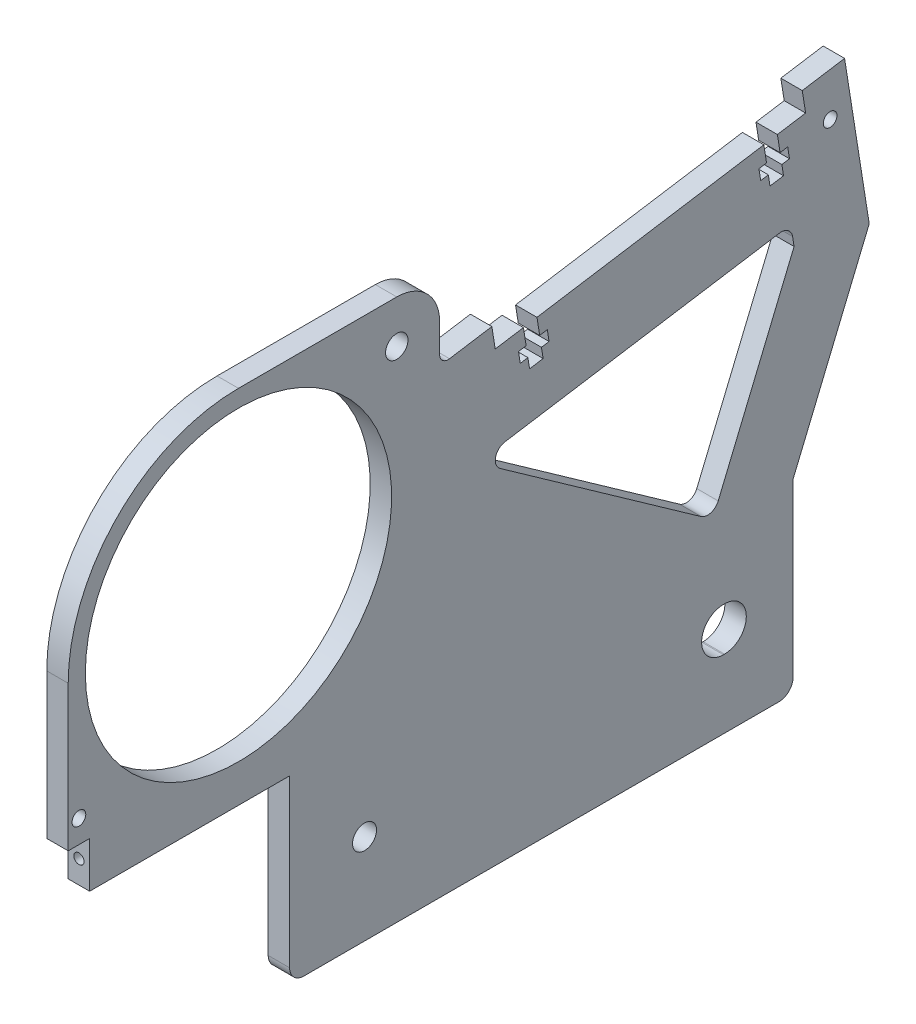
from build123d import *

# Parameters (mm, degrees)
SKETCH1_R           = 1.524
SKETCH1_R_2         = 2.667
SKETCH1_R_3         = 34.04
SKETCH1_R_4         = 2.4892
BOSS_EXTRUDE1_DEPTH = 4.7625
SKETCH2_R           = 1.1303
CUT_EXTRUDE1_DEPTH  = 6.35


with BuildPart() as part:
    # Sketch1 → Boss-Extrude1 (new body)
    with BuildSketch(Plane(origin=(0, 0, 0), x_dir=(0, 0, -1), z_dir=(1, 0, 0))):
        with BuildLine():
            Line((-28.170295117, 0), (77.382795117, 0))
            ThreePointArc((77.382795117, 0), (79.627859148, 0.92993597), (80.557795117, 3.175))
            Line((80.557795117, 3.175), (80.557795117, 38.504743526))
            Line((80.557795117, 38.504743526), (80.557795117, 41.307035595))
            Line((80.557795117, 41.307035595), (97.47645297, 81.978005717))
            Line((97.47645297, 81.978005717), (92.000706017, 116.550511334))
            Line((92.000706017, 116.550511334), (82.592974573, 115.060473054))
            Line((82.592974573, 115.060473054), (83.337993713, 110.356607332))
            Line((83.337993713, 110.356607332), (77.06617275, 109.363248479))
            Line((77.06617275, 109.363248479), (77.667154856, 105.568796797))
            Line((77.667154856, 105.568796797), (79.360546516, 105.837003687))
            Line((79.360546516, 105.837003687), (79.752923263, 103.359634407))
            Line((79.752923263, 103.359634407), (78.059531603, 103.091427516))
            Line((78.059531603, 103.091427516), (78.432041173, 100.739494655))
            Line((78.432041173, 100.739494655), (75.421567111, 100.262682406))
            Line((75.421567111, 100.262682406), (75.049057541, 102.614615267))
            Line((75.049057541, 102.614615267), (73.355665881, 102.346408377))
            Line((73.355665881, 102.346408377), (72.963289134, 104.823777657))
            Line((72.963289134, 104.823777657), (74.656680794, 105.091984547))
            Line((74.656680794, 105.091984547), (74.055698688, 108.88643623))
            Line((74.055698688, 108.88643623), (23.630258147, 100.899831052))
            Line((23.630258147, 100.899831052), (24.231240253, 97.105379369))
            Line((24.231240253, 97.105379369), (25.924631913, 97.373586259))
            Line((25.924631913, 97.373586259), (26.31700866, 94.896216979))
            Line((26.31700866, 94.896216979), (24.623617, 94.628010089))
            Line((24.623617, 94.628010089), (24.99612657, 92.276077228))
            Line((24.99612657, 92.276077228), (21.985652508, 91.799264978))
            Line((21.985652508, 91.799264978), (21.613142938, 94.151197839))
            Line((21.613142938, 94.151197839), (19.919751278, 93.882990949))
            Line((19.919751278, 93.882990949), (19.527374531, 96.360360229))
            Line((19.527374531, 96.360360229), (21.220766191, 96.62856712))
            Line((21.220766191, 96.62856712), (20.619784085, 100.423018802))
            Line((20.619784085, 100.423018802), (14.347963122, 99.429659949))
            Line((14.347963122, 99.429659949), (13.602943983, 104.133525671))
            Line((13.602943983, 104.133525671), (4.195212538, 102.643487392))
            ThreePointArc((4.195212538, 102.643487392), (2.66000635, 103.076460316), (1.992204883, 104.52503368))
            Line((1.992204883, 104.52503368), (1.992204883, 110.875))
            ThreePointArc((1.992204883, 110.875), (-0.797603027, 117.610192091), (-7.532795117, 120.4))
            Line((-7.532795117, 120.4), (-42.707795117, 120.4))
            ThreePointArc((-42.707795117, 120.4), (-69.471786785, 109.313991668), (-80.557795117, 82.55))
            Line((-80.557795117, 82.55), (-80.557795117, 50.292))
            Line((-80.557795117, 50.292), (-75.795295117, 50.292))
            Line((-75.795295117, 50.292), (-75.795295117, 40.132))
            Line((-75.795295117, 40.132), (-31.345295117, 40.132))
            Line((-31.345295117, 40.132), (-31.345295117, 3.175))
            ThreePointArc((-31.345295117, 3.175), (-30.415359148, 0.92993597), (-28.170295117, 0))
        make_face()
        with Locations((-78.176545117, 55.372)):
            Circle(SKETCH1_R, mode=Mode.SUBTRACT)
        with Locations((-14.692204883, 20.066)):
            Circle(SKETCH1_R_2, mode=Mode.SUBTRACT)
        with Locations((-42.707795117, 82.55)):
            Circle(SKETCH1_R_3, mode=Mode.SUBTRACT)
        with Locations((88.786878575, 106.39776075)):
            Circle(SKETCH1_R, mode=Mode.SUBTRACT)
        with Locations((-7.532795117, 110.875)):
            Circle(SKETCH1_R_4, mode=Mode.SUBTRACT)
        with BuildLine():
            Line((65.317795117, 15.2273), (65.063795117, 15.2273))
            ThreePointArc((65.063795117, 15.2273), (60.225095117, 20.066), (65.063795117, 24.9047))
            Line((65.063795117, 24.9047), (65.317795117, 24.9047))
            ThreePointArc((65.317795117, 24.9047), (70.156495117, 20.066), (65.317795117, 15.2273))
        make_face(mode=Mode.SUBTRACT)
        with BuildLine():
            Line((77.537520924, 90.15044205), (16.505444161, 80.48391073))
            ThreePointArc((16.505444161, 80.48391073), (14.429240829, 78.552387567), (15.436115304, 75.901424384))
            Line((15.436115304, 75.901424384), (60.099239023, 44.313277635))
            ThreePointArc((60.099239023, 44.313277635), (62.269082169, 43.94630806), (63.911091021, 45.411467736))
            Line((63.911091021, 45.411467736), (80.774519188, 85.949670538))
            Line((80.774519188, 85.949670538), (80.44359285, 88.039057206))
            ThreePointArc((80.44359285, 88.039057206), (79.427839006, 89.69661683), (77.537520924, 90.15044205))
        make_face(mode=Mode.SUBTRACT)
    extrude(amount=BOSS_EXTRUDE1_DEPTH)

    # Sketch2 → Cut-Extrude1 (cut)
    with BuildSketch(Plane.XY.offset(75.795295117)):
        with Locations((2.38125, 45.212)):
            Circle(SKETCH2_R)
    extrude(amount=-CUT_EXTRUDE1_DEPTH, mode=Mode.SUBTRACT)


solid = part.part
